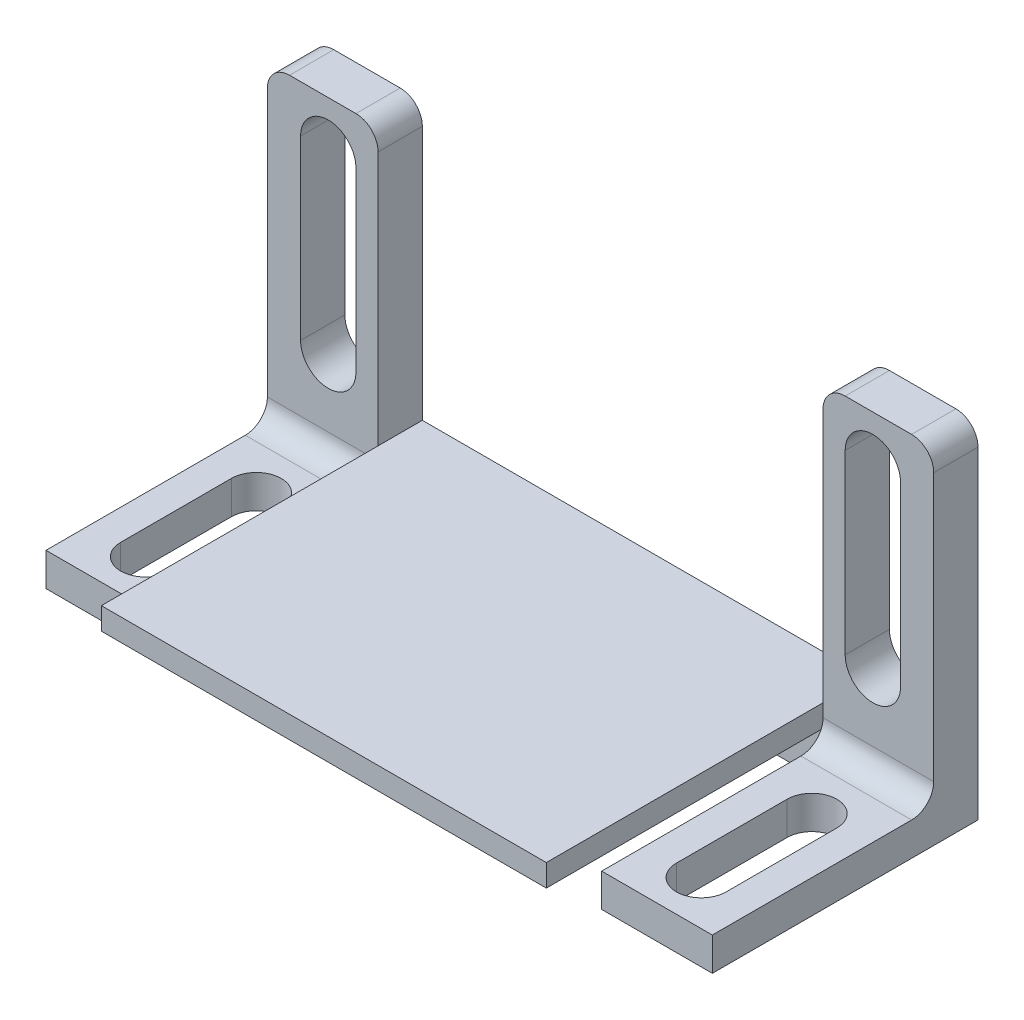
from build123d import *

# Parameters (mm, degrees)
SKETCH1_W             = 10
SKETCH1_H             = 25
BOSS_EXTRUDE1_DEPTH   = 4
BOSS_EXTRUDE1_2_DEPTH = 4
SKETCH1_3_W           = 40.2
SKETCH1_3_H           = 2
BOSS_EXTRUDE2_DEPTH   = 29
SKETCH1_4_W           = 10
SKETCH1_4_H           = 2
BOSS_EXTRUDE3_DEPTH   = 4
FILLET2_R             = 2
SKETCH2_W             = 60.2
SKETCH2_H             = 4
BOSS_EXTRUDE5_DEPTH   = 4.17
SKETCH3_W             = 10
SKETCH3_H             = 3
BOSS_EXTRUDE6_DEPTH   = 20
FILLET3_R             = 2
CUT_EXTRUDE1_DEPTH    = 15


with BuildPart() as part:
    # Sketch1 → Boss-Extrude1 (new body)
    with BuildSketch(Plane.XY):
        with Locations((5, 12.5)):
            Rectangle(SKETCH1_W, SKETCH1_H)
        with BuildLine():
            ThreePointArc((3, 4.75), (5.5, 2.25), (8, 4.75))
            Line((8, 4.75), (8, 20.75))
            ThreePointArc((8, 20.75), (5.5, 23.25), (3, 20.75))
            Line((3, 20.75), (3, 4.75))
        make_face(mode=Mode.SUBTRACT)
    extrude(amount=BOSS_EXTRUDE1_DEPTH)



with BuildPart() as body_2:
    # Sketch1 → Boss-Extrude1 2 (new body)
    with BuildSketch(Plane.XY):
        with Locations((55.2, 12.5)):
            Rectangle(SKETCH1_W, SKETCH1_H)
        with BuildLine():
            Line((57.2, 20.75), (57.2, 4.75))
            ThreePointArc((57.2, 4.75), (54.7, 2.25), (52.2, 4.75))
            Line((52.2, 4.75), (52.2, 20.75))
            ThreePointArc((52.2, 20.75), (54.7, 23.25), (57.2, 20.75))
        make_face(mode=Mode.SUBTRACT)
    extrude(amount=BOSS_EXTRUDE1_2_DEPTH)


with BuildPart() as body_3:
    # Sketch1<3> → Boss-Extrude2 (new body)
    with BuildSketch(Plane.XY):
        with Locations((30.1, -1)):
            Rectangle(SKETCH1_3_W, SKETCH1_3_H)
    extrude(amount=BOSS_EXTRUDE2_DEPTH)


with BuildPart() as part_1:
    add(part.part)

    add(body_2.part)  # Boss-Extrude3 merges body 2

    add(body_3.part)  # Boss-Extrude3 merges body 3
    # Sketch1<4> → Boss-Extrude3 (add)
    with BuildSketch(Plane.XY):
        with Locations((5, -1)):
            Rectangle(SKETCH1_4_W, SKETCH1_4_H)
        with Locations((55.2, -1)):
            Rectangle(SKETCH1_4_W, SKETCH1_4_H)
    extrude(amount=BOSS_EXTRUDE3_DEPTH)

    # Fillet2
    fillet2_edges = [part_1.edges().sort_by_distance(p)[0] for p in [
        (0, 25, 2),
        (10, 25, 2),
        (60.2, 25, 2),
        (50.2, 25, 2),
    ]]
    fillet(fillet2_edges, radius=FILLET2_R)

    # Sketch2 → Boss-Extrude5 (add)
    with BuildSketch(Plane.XZ.offset(2)):
        with Locations((30.1, 2)):
            Rectangle(SKETCH2_W, SKETCH2_H)
    extrude(amount=BOSS_EXTRUDE5_DEPTH)

    # Sketch3 → Boss-Extrude6 (add)
    with BuildSketch(Plane.XY.offset(4)):
        with Locations((5, -4.67)):
            Rectangle(SKETCH3_W, SKETCH3_H)
        with Locations((55.2, -4.67)):
            Rectangle(SKETCH3_W, SKETCH3_H)
    extrude(amount=BOSS_EXTRUDE6_DEPTH)

    # Fillet3
    # the kernel refuses this fillet: 2 mm, written as the material it adds along each edge
    with BuildSketch(Plane(origin=(60.2, -3.17, 4), x_dir=(0, 1, 0), z_dir=(-1, 0, 0)), Plane(origin=(10, -3.17, 4), x_dir=(0, 1, 0), z_dir=(-1, 0, 0))) as fillet3_piece_1:
        with BuildLine():
            CenterArc((FILLET3_R, -FILLET3_R), FILLET3_R, 90, 90)
            Line((0, -FILLET3_R), (0, 0))
            Line((0, 0), (FILLET3_R, 0))
        make_face()
    extrude(amount=10)

    # Sketch4 → Cut-Extrude1 (cut)
    with BuildSketch(Plane(origin=(0, -3.17, 0), x_dir=(1, 0, 0), z_dir=(0, 1, 0))):
        with BuildLine():
            Line((7.25, -20), (7.25, -10))
            ThreePointArc((7.25, -10), (5, -7.75), (2.75, -10))
            Line((2.75, -10), (2.75, -20))
            ThreePointArc((2.75, -20), (5, -22.25), (7.25, -20))
        make_face()
        with BuildLine():
            ThreePointArc((52.95, -10), (55.2, -7.75), (57.45, -10))
            Line((57.45, -10), (57.45, -20))
            ThreePointArc((57.45, -20), (55.2, -22.25), (52.95, -20))
            Line((52.95, -20), (52.95, -10))
        make_face()
    extrude(amount=-CUT_EXTRUDE1_DEPTH, mode=Mode.SUBTRACT)


solid = part_1.part
